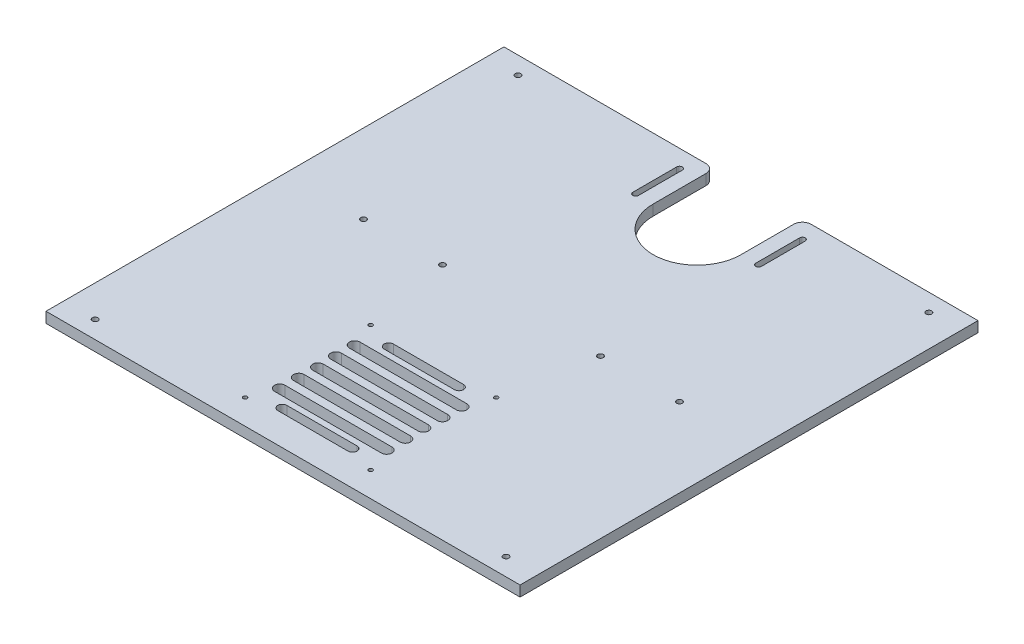
from build123d import *

# Parameters (mm, degrees)
SKETCH1_R               = 1.6
BOSS_EXTRUDE1_DEPTH     = 6
CUT_EXTRUDE1_DEPTH      = 203.20197823
CUT_EXTRUDE1_DEPTH_BACK = 203.20197823
SKETCH4_R               = 1.6
CUT_EXTRUDE2_DEPTH      = 10
CUT_EXTRUDE3_DEPTH      = 10
FILLET1_R               = 5
SKETCH6_R               = 1.125
CUT_EXTRUDE4_DEPTH      = 10


with BuildPart() as part:
    # Sketch1 → Boss-Extrude1 (new body)
    with BuildSketch(Plane(origin=(0, 0, 0), x_dir=(1, 0, 0), z_dir=(0, 1, 0))):
        Polygon((-145, 120), (125, 120), (125, -100.8), (125, -140.8), (-145, -140.8), (-145, -100.8), align=None)
        with Locations((-100, -5)):
            Circle(SKETCH1_R, mode=Mode.SUBTRACT)
        with Locations((80, -5)):
            Circle(SKETCH1_R, mode=Mode.SUBTRACT)
        with Locations((-55, -5)):
            Circle(SKETCH1_R, mode=Mode.SUBTRACT)
        with Locations((35, -5)):
            Circle(SKETCH1_R, mode=Mode.SUBTRACT)
    extrude(amount=BOSS_EXTRUDE1_DEPTH)

    # Sketch3 → Cut-Extrude1 (cut, two sides: drawn at the far end of the back side and taken through both)
    with BuildSketch(Plane(origin=(0, 6, 0), x_dir=(1, 0, 0), z_dir=(0, 1, 0)).offset(-CUT_EXTRUDE1_DEPTH_BACK)):
        with BuildLine():
            Line((-25, 85), (-25, 120))
            Line((-25, 120), (25, 120))
            Line((25, 120), (25, 85))
            ThreePointArc((25, 85), (0, 60), (-25, 85))
        make_face()
    extrude(amount=CUT_EXTRUDE1_DEPTH + CUT_EXTRUDE1_DEPTH_BACK, mode=Mode.SUBTRACT)

    # Sketch4 → Cut-Extrude2 (cut)
    with BuildSketch(Plane.XZ):
        with Locations((107, -110)):
            Circle(SKETCH4_R)
        with Locations((-127, -110)):
            Circle(SKETCH4_R)
        with Locations((107, 130.8)):
            Circle(SKETCH4_R)
        with Locations((-127, 130.8)):
            Circle(SKETCH4_R)
    extrude(amount=-CUT_EXTRUDE2_DEPTH, mode=Mode.SUBTRACT)

    # Sketch5 → Cut-Extrude3 (cut)
    with BuildSketch(Plane(origin=(0, 6, 0), x_dir=(1, 0, 0), z_dir=(0, 1, 0))):
        with BuildLine():
            Line((-33.4, 110), (-33.4, 85))
            ThreePointArc((-33.4, 85), (-35, 83.4), (-36.6, 85))
            Line((-36.6, 85), (-36.6, 110))
            ThreePointArc((-36.6, 110), (-35, 111.6), (-33.4, 110))
        make_face()
        with BuildLine():
            Line((33.4, 110), (33.4, 85))
            ThreePointArc((33.4, 85), (35, 83.4), (36.6, 85))
            Line((36.6, 85), (36.6, 110))
            ThreePointArc((36.6, 110), (35, 111.6), (33.4, 110))
        make_face()
    extrude(amount=-CUT_EXTRUDE3_DEPTH, mode=Mode.SUBTRACT)

    # Fillet1
    fillet1_edges = [part.edges().sort_by_distance(p)[0] for p in [
        (25, 3, -120),
        (-25, 3, -120),
    ]]
    fillet(fillet1_edges, radius=FILLET1_R)

    # Sketch6 → Cut-Extrude4 (cut)
    with BuildSketch(Plane(origin=(0, 6, 0), x_dir=(1, 0, 0), z_dir=(0, 1, 0))):
        with Locations((25.75, -55.149373751)):
            Circle(SKETCH6_R)
        with Locations((-45.75, -55.149373751)):
            Circle(SKETCH6_R)
        with Locations((-45.75, -126.649373751)):
            Circle(SKETCH6_R)
        with Locations((25.75, -126.649373751)):
            Circle(SKETCH6_R)
        with BuildLine():
            Line((-40, -87.899373751), (20, -87.899373751))
            ThreePointArc((20, -87.899373751), (23, -90.899373751), (20, -93.899373751))
            Line((20, -93.899373751), (-40, -93.899373751))
            ThreePointArc((-40, -93.899373751), (-43, -90.899373751), (-40, -87.899373751))
        make_face()
        with BuildLine():
            Line((-40.316760433, -77.325947728), (20.316760433, -77.325947728))
            ThreePointArc((20.316760433, -77.325947728), (23.316760433, -80.325947728), (20.316760433, -83.325947728))
            Line((20.316760433, -83.325947728), (-40.316760433, -83.325947728))
            ThreePointArc((-40.316760433, -83.325947728), (-43.316760433, -80.325947728), (-40.316760433, -77.325947728))
        make_face()
        with BuildLine():
            Line((-40.436008981, -66.571059525), (20.436008981, -66.571059525))
            ThreePointArc((20.436008981, -66.571059525), (23.436008981, -69.571059525), (20.436008981, -72.571059525))
            Line((20.436008981, -72.571059525), (-40.436008981, -72.571059525))
            ThreePointArc((-40.436008981, -72.571059525), (-43.436008981, -69.571059525), (-40.436008981, -66.571059525))
        make_face()
        with BuildLine():
            Line((-30, -58.021465569), (10, -58.021465569))
            ThreePointArc((10, -58.021465569), (12.570860459, -60.592326028), (10, -63.163186487))
            Line((10, -63.163186487), (-30, -63.163186487))
            ThreePointArc((-30, -63.163186487), (-32.570860459, -60.592326028), (-30, -58.021465569))
        make_face()
        with BuildLine():
            Line((-30, -123.777281933), (10, -123.777281933))
            ThreePointArc((10, -123.777281933), (12.570860459, -121.206421475), (10, -118.635561016))
            Line((10, -118.635561016), (-30, -118.635561016))
            ThreePointArc((-30, -118.635561016), (-32.570860459, -121.206421475), (-30, -123.777281933))
        make_face()
        with BuildLine():
            Line((-40.436008981, -115.227687978), (20.436008981, -115.227687978))
            ThreePointArc((20.436008981, -115.227687978), (23.436008981, -112.227687978), (20.436008981, -109.227687978))
            Line((20.436008981, -109.227687978), (-40.436008981, -109.227687978))
            ThreePointArc((-40.436008981, -109.227687978), (-43.436008981, -112.227687978), (-40.436008981, -115.227687978))
        make_face()
        with BuildLine():
            Line((-40.316760433, -104.472799775), (20.316760433, -104.472799775))
            ThreePointArc((20.316760433, -104.472799775), (23.316760433, -101.472799775), (20.316760433, -98.472799775))
            Line((20.316760433, -98.472799775), (-40.316760433, -98.472799775))
            ThreePointArc((-40.316760433, -98.472799775), (-43.316760433, -101.472799775), (-40.316760433, -104.472799775))
        make_face()
    extrude(amount=-CUT_EXTRUDE4_DEPTH, mode=Mode.SUBTRACT)


solid = part.part
